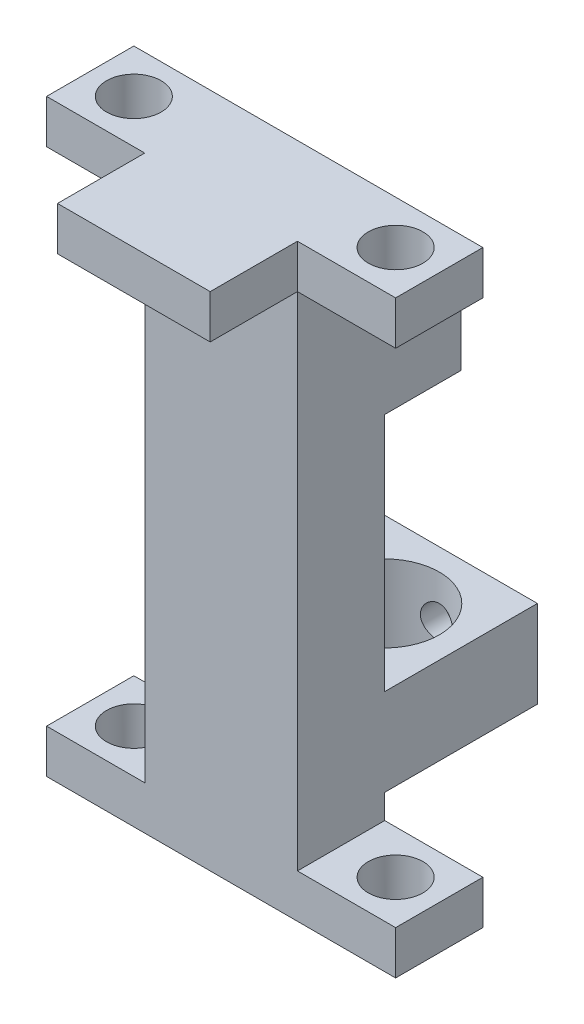
from build123d import *

# Parameters (mm, degrees)
ESQUISSE1_W             = 32
ESQUISSE1_H             = 54
BOSS_EXTRU_1_DEPTH      = 8
ESQUISSE2_W             = 32
ESQUISSE2_H             = 4
BOSS_EXTRU_2_DEPTH      = 10
ESQUISSE3_W             = 8
ESQUISSE3_H             = 46
ENL_V_MAT_EXTRU_1_DEPTH = 9
ESQUISSE4_W             = 8
ESQUISSE4_H             = 46
ENL_V_MAT_EXTRU_2_DEPTH = 9
ESQUISSE5_R             = 2.5
ENL_V_MAT_EXTRU_3_DEPTH = 54
ESQUISSE6_W             = 14
ESQUISSE6_H             = 8
BOSS_EXTRU_3_DEPTH      = 14
ESQUISSE9_W             = 9
ESQUISSE9_H             = 10
ENL_V_MAT_EXTRU_6_DEPTH = 4
ESQUISSE10_W            = 14
ESQUISSE10_H            = 6
BOSS_EXTRU_4_DEPTH      = 7
ESQUISSE7_R             = 5
ENL_V_MAT_EXTRU_4_DEPTH = 55.118693403
ESQUISSE8_R             = 1.5
ENL_V_MAT_EXTRU_5_DEPTH = 7
ENL_V_MAT_EXTRU_7_DEPTH = 6
ESQUISSE12_W            = 14
ESQUISSE12_H            = 2
ENL_V_MAT_EXTRU_8_DEPTH = 66.299310869


with BuildPart() as part:
    # Esquisse1 → Boss.-Extru.1 (new body)
    with BuildSketch(Plane.XY):
        with Locations((16, 27)):
            Rectangle(ESQUISSE1_W, ESQUISSE1_H)
    extrude(amount=BOSS_EXTRU_1_DEPTH)

    # Esquisse2 → Boss.-Extru.2 (add)
    with BuildSketch(Plane.XY.offset(8)):
        with Locations((16, 52)):
            Rectangle(ESQUISSE2_W, ESQUISSE2_H)
    extrude(amount=BOSS_EXTRU_2_DEPTH)

    # Esquisse3 → Enlèv. mat.-Extru.1 (cut)
    with BuildSketch(Plane(origin=(32, 0, 0), x_dir=(0, 0, -1), z_dir=(1, 0, 0))):
        with Locations((-4, 27)):
            Rectangle(ESQUISSE3_W, ESQUISSE3_H)
    extrude(amount=-ENL_V_MAT_EXTRU_1_DEPTH, mode=Mode.SUBTRACT)

    # Esquisse4 → Enlèv. mat.-Extru.2 (cut)
    with BuildSketch(Plane.ZY):
        with Locations((4, 27)):
            Rectangle(ESQUISSE4_W, ESQUISSE4_H)
    extrude(amount=-ENL_V_MAT_EXTRU_2_DEPTH, mode=Mode.SUBTRACT)

    # Esquisse5 → Enlèv. mat.-Extru.3 (cut)
    with BuildSketch(Plane(origin=(0, 54, 0), x_dir=(1, 0, 0), z_dir=(0, 1, 0))):
        with Locations((4, -4)):
            Circle(ESQUISSE5_R)
        with Locations((28, -4)):
            Circle(ESQUISSE5_R)
    extrude(amount=-ENL_V_MAT_EXTRU_3_DEPTH, mode=Mode.SUBTRACT)

    # Esquisse6 → Boss.-Extru.3 (add)
    with BuildSketch(Plane(origin=(0, 0, 0), x_dir=(-1, 0, 0), z_dir=(0, 0, -1))):
        with Locations((-16, 10.240309664)):
            Rectangle(ESQUISSE6_W, ESQUISSE6_H)
    extrude(amount=BOSS_EXTRU_3_DEPTH)

    # Esquisse9 → Enlèv. mat.-Extru.6 (cut)
    with BuildSketch(Plane(origin=(0, 54, 0), x_dir=(1, 0, 0), z_dir=(0, 1, 0))):
        with Locations((27.5, -13)):
            Rectangle(ESQUISSE9_W, ESQUISSE9_H)
        with Locations((4.5, -13)):
            Rectangle(ESQUISSE9_W, ESQUISSE9_H)
    extrude(amount=-ENL_V_MAT_EXTRU_6_DEPTH, mode=Mode.SUBTRACT)

    # Esquisse10 → Boss.-Extru.4 (add)
    with BuildSketch(Plane(origin=(0, 0, 0), x_dir=(-1, 0, 0), z_dir=(0, 0, -1))):
        with Locations((-16, 39.240309664)):
            Rectangle(ESQUISSE10_W, ESQUISSE10_H)
    extrude(amount=BOSS_EXTRU_4_DEPTH)

    # Esquisse7 → Enlèv. mat.-Extru.4 (cut, through all)
    with BuildSketch(Plane(origin=(0, 14.240309664, 0), x_dir=(1, 0, 0), z_dir=(0, 1, 0))):
        with Locations((16, 7)):
            Circle(ESQUISSE7_R)
    extrude(amount=-ENL_V_MAT_EXTRU_4_DEPTH, mode=Mode.SUBTRACT)

    # Esquisse8 → Enlèv. mat.-Extru.5 (cut)
    with BuildSketch(Plane(origin=(0, 0, -14), x_dir=(-1, 0, 0), z_dir=(0, 0, -1))):
        with Locations((-16, 10.240309664)):
            Circle(ESQUISSE8_R)
    extrude(amount=-ENL_V_MAT_EXTRU_5_DEPTH, mode=Mode.SUBTRACT)

    # Esquisse11 → Enlèv. mat.-Extru.7 (cut)
    with BuildSketch(Plane(origin=(0, 42.240309664, 0), x_dir=(1, 0, 0), z_dir=(0, 1, 0))):
        Polygon((21, 7), (16, 2), (11, 7), align=None)
    extrude(amount=-ENL_V_MAT_EXTRU_7_DEPTH, mode=Mode.SUBTRACT)

    # Esquisse12 → Enlèv. mat.-Extru.8 (cut, through all)
    with BuildSketch(Plane(origin=(0, 54, 0), x_dir=(1, 0, 0), z_dir=(0, 1, 0))):
        with Locations((16, -17)):
            Rectangle(ESQUISSE12_W, ESQUISSE12_H)
    extrude(amount=-ENL_V_MAT_EXTRU_8_DEPTH, mode=Mode.SUBTRACT)


solid = part.part
